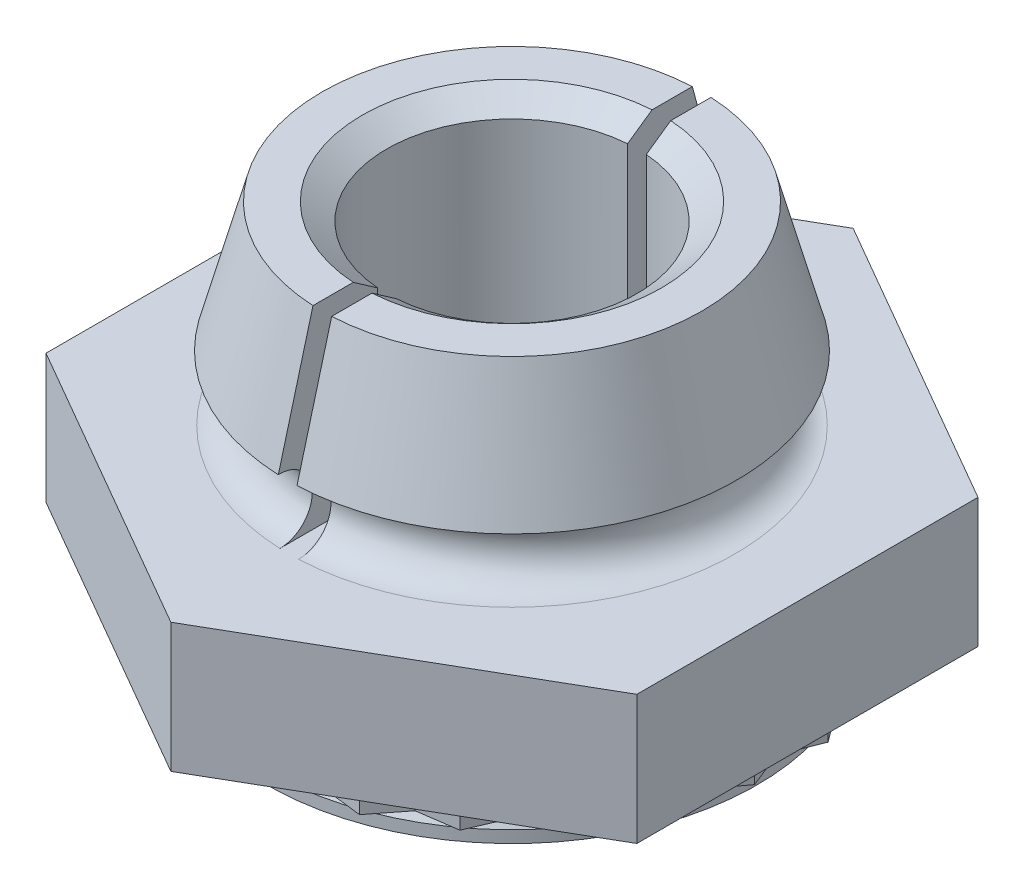
from build123d import *

# Parameters (mm, degrees)
HEXDIESKE_R                = 5.6515
HEXDIE_DEPTH               = 10.998522628
SLIT_START                 = 2.0828
SLIT_DEPTH                 = 3.1242
CLINCHINGRINGSEGMENT_DEPTH = 0.38608
CLINCHINGRING_COUNT        = 24
CLINCHINGRING_ANGLE        = 345


# Read off the part's stored shape, not the designer's step: Slit
with BuildPart() as part:
    # BodySke → Body (revolve)
    with BuildSketch(Plane.XY, mode=Mode.PRIVATE) as body_sk:
        with BuildLine():
            Line((3.726796608, 0), (5.5245, 0))
            Line((5.5245, 0), (5.5245, 2.0828))
            Line((5.5245, 2.0828), (3.5941, 2.0828))
            ThreePointArc((3.5941, 2.0828), (3.0734, 2.6035), (3.5941, 3.1242))
            Line((3.5941, 3.1242), (3.6195, 3.1242))
            Line((3.6195, 3.1242), (3.061415422, 5.207))
            Line((3.061415422, 5.207), (2.0193, 5.207))
            Line((2.0193, 5.207), (2.0193, -0.9652))
            Line((2.0193, -0.9652), (3.9497, -0.9652))
            Line((3.9497, -0.9652), (3.9497, -0.77216))
            Line((3.9497, -0.77216), (3.726796608, -0.38608))
            Line((3.726796608, -0.38608), (3.726796608, 0))
        make_face()
    revolve(body_sk.sketch.rotate(Axis((0, 3.1242, 0), (0, 1, 0)), 90), axis=Axis((0, 3.1242, 0), (0, 1, 0)))

    # HexDieSke → HexDie (cut)
    with BuildSketch(Plane(origin=(0, 0, 0), x_dir=(1, 0, 0), z_dir=(0, 1, 0))):
        Circle(HEXDIESKE_R)
        Polygon((-4.7625, -2.749630657), (0, -5.499261314), (4.7625, -2.749630657), (4.7625, 2.749630657), (0, 5.499261314), (-4.7625, 2.749630657), align=None, mode=Mode.SUBTRACT)
    extrude(amount=HEXDIE_DEPTH, mode=Mode.SUBTRACT)

    # Slit outline → Slit (cut)
    with BuildSketch(Plane(origin=(0, 0, 0), x_dir=(1, 0, 0), z_dir=(0, 1, 0)).offset(SLIT_START)):
        with BuildLine():
            ThreePointArc((-0.1508125, 2.013660369), (0, 2.0193), (0.1508125, 2.013660369))
            Line((0.1508125, 2.013660369), (0.1508125, 5))
            Line((0.1508125, 5), (-0.1508125, 5))
            Line((-0.1508125, 5), (-0.1508125, 2.013660369))
        make_face()
        with BuildLine():
            Line((0.1508125, -5), (0.1508125, -2.013660369))
            ThreePointArc((0.1508125, -2.013660369), (0, -2.0193), (-0.1508125, -2.013660369))
            Line((-0.1508125, -2.013660369), (-0.1508125, -5))
            Line((-0.1508125, -5), (0.1508125, -5))
        make_face()
    extrude(amount=SLIT_DEPTH, mode=Mode.SUBTRACT)

    # EndChamferSke → EndChamfer (revolve, cut)
    with BuildSketch(Plane.XY, mode=Mode.PRIVATE) as endchamfer_sk:
        Polygon((2.413, -1.2192), (2.413, -0.96266), (2.0193, -0.687090683), (2.0193, -1.2192), align=None)
        Polygon((2.413, 5.207), (2.0193, 4.931430683), (2.0193, 5.207), align=None)
    revolve(endchamfer_sk.sketch.rotate(Axis((0, -2.54, 0), (0, 1, 0)), 90), axis=Axis((0, -2.54, 0), (0, 1, 0)), mode=Mode.SUBTRACT)

    # CliRinSegSke → ClinchingRingSegment (add)
    with BuildSketch(Plane.XZ):
        Polygon((0.592870197, 4.503296234), (0, 4.265676), (-0.592870197, 4.503296234), (-0.569155389, 4.323164385), (0, 4.09504896), (0.569155389, 4.323164385), align=None)
    clinchingringsegment = extrude(amount=CLINCHINGRINGSEGMENT_DEPTH)

    # ClinchingRing: ClinchingRingSegment ×24 about axis
    clinchingring_axis = Axis((0, 0, 0), (0, 1, 0))
    for i in range(1, CLINCHINGRING_COUNT):
        add(clinchingringsegment.rotate(clinchingring_axis, i * CLINCHINGRING_ANGLE / (CLINCHINGRING_COUNT - 1)))


solid = part.part
